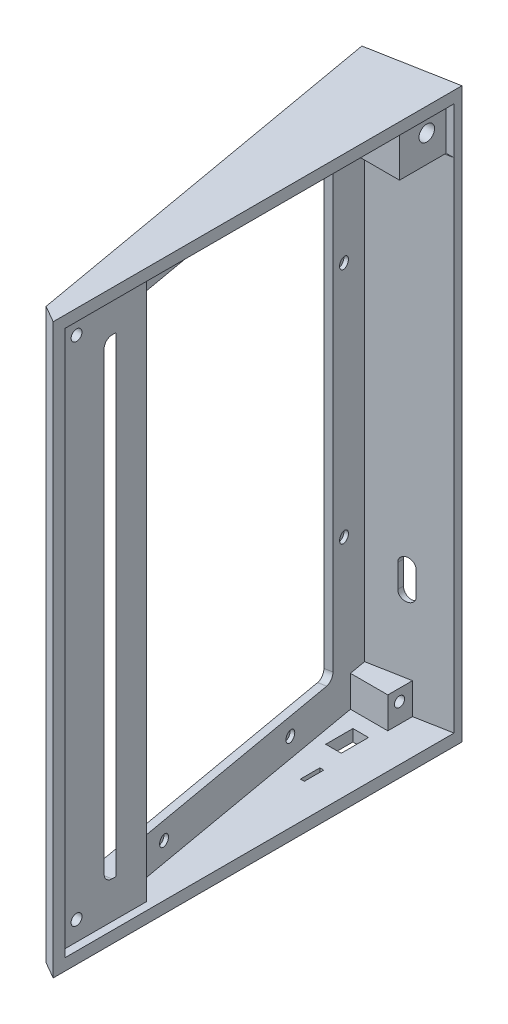
from build123d import *
from build123d.topology import SkipClean

# Parameters (mm, degrees)
EXTRUDE_1_DEPTH      = 180
SKETCH_5_W           = 76
SKETCH_5_H           = 121
CUT_EXTRUDE_2_DEPTH  = 2
CUT_EXTRUDE_3_REACH  = 232.539
SKETCH_7_W           = 99
SKETCH_7_H           = 174
SKETCH_10_R          = 1.4
CUT_EXTRUDE_5_DEPTH  = 1
SKETCH_11_R          = 1.4
CUT_EXTRUDE_6_DEPTH  = 1
EXTRUDE_3_REACH      = 232.539
SKETCH_12_W          = 23
SKETCH_12_H          = 140
SKETCH_13_W          = 11.509871418
SKETCH_13_H          = 121
CUT_EXTRUDE_7_DEPTH  = 2
SKETCH_17_W          = 22.064106518
SKETCH_17_H          = 180
EXTRUDE_9_DEPTH      = 2
CUT_EXTRUDE_9_DEPTH  = 180
CUT_EXTRUDE_10_DEPTH = 174
SKETCH_20_W          = 23
SKETCH_20_H          = 140
CUT_EXTRUDE_11_DEPTH = 2
EXTRUDE_10_REACH     = 232.359
SKETCH_23_W          = 12
SKETCH_23_H          = 12
FILLET_4_R           = 2
CUT_EXTRUDE_15_REACH = 243.825
EXTRUDE_11_REACH     = 232.539
SKETCH_27_W          = 8
SKETCH_27_H          = 8
SKETCH_28_W          = 8
SKETCH_28_H          = 8
CUT_EXTRUDE_16_DEPTH = 9
EXTRUDE_12_DEPTH     = 8
CUT_EXTRUDE_17_REACH = 243.825
CUT_EXTRUDE_18_REACH = 246.03
SKETCH_31_W          = 4
SKETCH_31_H          = 7
CUT_EXTRUDE_23_REACH = 225.195
CUT_EXTRUDE_25_REACH = 224.966
SKETCH_35_W          = 8
SKETCH_35_H          = 16
FILLET_5_R           = 0.5
CUT_EXTRUDE_26_REACH = 246.03
SKETCH_36_W          = 1
SKETCH_36_H          = 5
SKETCH_37_W          = 2
SKETCH_37_H          = 6
CUT_EXTRUDE_27_DEPTH = 1
SKETCH_38_R          = 1.3
CUT_EXTRUDE_28_DEPTH = 3
SKETCH_39_R          = 2
CUT_EXTRUDE_30_DEPTH = 3
SKETCH_40_R          = 1.4
CUT_EXTRUDE_31_DEPTH = 2
CUT_EXTRUDE_34_DEPTH = 2
CUT_EXTRUDE_35_DEPTH = 1
SKETCH_45_W          = 45.630615172
SKETCH_45_H          = 107.719789164
CUT_EXTRUDE_36_DEPTH = 34
SKETCH_47_R          = 1.4
CUT_EXTRUDE_37_DEPTH = 3
EXTRUDE_13_REACH     = 207.096
SKETCH_48_W          = 12
SKETCH_48_H          = 12
SKETCH_50_W          = 12
SKETCH_50_H          = 12
CUT_EXTRUDE_38_DEPTH = 2
SKETCH_51_R          = 2
CUT_EXTRUDE_39_DEPTH = 3
CUT_EXTRUDE_40_DEPTH = 211.503077075


with BuildPart() as part:
    # 草图1 → 凸台-拉伸1 (new body)
    with BuildSketch(Plane(origin=(0, 0, 0), x_dir=(1, 0, 0), z_dir=(0, 1, 0))):
        Polygon((82.903530501, -37.399262949), (82.903530501, -142.399262949), (78.573403482, -139.899262949), (61.208585715, -41.418487648), align=None)
    extrude(amount=EXTRUDE_1_DEPTH)

    # 草图5 → 切除-拉伸2 (cut)
    with BuildSketch(Plane(origin=(52.279942479, 0, -9.218364409), x_dir=(0.17364817766692414, 0, 0.9848077530122091), z_dir=(-0.9848077530122091, 0, 0.17364817766692414))):
        with Locations((101.418007121, 73)):
            Rectangle(SKETCH_5_W, SKETCH_5_H)
    extrude(amount=-CUT_EXTRUDE_2_DEPTH, mode=Mode.SUBTRACT)

    # 切除-拉伸3: up to this plane
    cut_extrude_3_end = Plane(origin=(54.249557985, 0, -9.565660764), z_dir=(-0.9848077530122091, 0, 0.17364817766692406))
    # 草图7 → 切除-拉伸3 (cut, up to the surface)
    with BuildSketch(Plane(origin=(82.903530501, 0, 0), x_dir=(0, 0, -1), z_dir=(1, 0, 0)), mode=Mode.PRIVATE) as cut_extrude_3_sk1:
        with Locations((-89.899262949, 90)):
            Rectangle(SKETCH_7_W, SKETCH_7_H)
    cut_extrude_3_tool1 = split(extrude(cut_extrude_3_sk1.sketch, amount=-CUT_EXTRUDE_3_REACH, mode=Mode.PRIVATE), bisect_by=cut_extrude_3_end, keep=Keep.BOTH, mode=Mode.PRIVATE)
    add(cut_extrude_3_tool1.solids().sort_by_distance((82.903531, 90, 89.899263))[0], mode=Mode.SUBTRACT)

    # 草图10 → 切除-拉伸5 (cut)
    with BuildSketch(Plane(origin=(54.249557985, 0, -9.565660764), x_dir=(-0.1736481776669242, 0, -0.9848077530122091), z_dir=(0.9848077530122091, 0, -0.1736481776669242))):
        with Locations((-59.918007121, 103.5)):
            Circle(SKETCH_10_R)
        with Locations((-59.918007121, 42.5)):
            Circle(SKETCH_10_R)
    extrude(amount=-CUT_EXTRUDE_5_DEPTH, mode=Mode.SUBTRACT)

    # 草图11 → 切除-拉伸6 (cut)
    with BuildSketch(Plane(origin=(54.249557985, 0, -9.565660764), x_dir=(-0.1736481776669242, 0, -0.9848077530122091), z_dir=(0.9848077530122091, 0, -0.1736481776669242))):
        with Locations((-116.918007121, 138)):
            Circle(SKETCH_11_R)
        with Locations((-76.918007121, 138)):
            Circle(SKETCH_11_R)
        with Locations((-116.918007121, 8)):
            Circle(SKETCH_11_R)
        with Locations((-76.918007121, 8)):
            Circle(SKETCH_11_R)
    extrude(amount=-CUT_EXTRUDE_6_DEPTH, mode=Mode.SUBTRACT)

    # 凸台-拉伸3: up to this plane
    extrude_3_end = Plane(origin=(54.249557985, 0, -9.565660764), z_dir=(-0.9848077530122091, 0, 0.17364817766692406))
    # 草图12 → 凸台-拉伸3 (add, up to the surface)
    with BuildSketch(Plane(origin=(82.903530501, 0, 0), x_dir=(0, 0, -1), z_dir=(1, 0, 0)), mode=Mode.PRIVATE) as extrude_3_sk1:
        with Locations((-127.899262949, 73)):
            Rectangle(SKETCH_12_W, SKETCH_12_H)
    extrude_3_tool1 = split(extrude(extrude_3_sk1.sketch, amount=-EXTRUDE_3_REACH, mode=Mode.PRIVATE), bisect_by=extrude_3_end, keep=Keep.BOTH, mode=Mode.PRIVATE)
    add(extrude_3_tool1.solids().sort_by_distance((82.903531, 73, 127.899263))[0])

    # 草图13 → 切除-拉伸7 (cut)
    with BuildSketch(Plane(origin=(54.249557985, 0, -9.565660764), x_dir=(0.1736481776669242, 0, 0.9848077530122091), z_dir=(-0.9848077530122091, 0, 0.1736481776669242))):
        with Locations((133.663071412, 73)):
            Rectangle(SKETCH_13_W, SKETCH_13_H)
    extrude(amount=-CUT_EXTRUDE_7_DEPTH, mode=Mode.SUBTRACT)

    # 草图17 → 凸台-拉伸9 (add)
    with BuildSketch(Plane(origin=(9.44967418, 0, 51.007389472), x_dir=(-0.9832686752161511, 0, 0.18216122622192457), z_dir=(-0.18216122622192457, 0, -0.9832686752161512))):
        with Locations((-63.671695749, 90)):
            Rectangle(SKETCH_17_W, SKETCH_17_H)
    extrude(amount=-EXTRUDE_9_DEPTH)

    # 草图18 → 切除-拉伸9 (cut)
    with BuildSketch(Plane.XZ):
        Polygon((82.903530501, 39.433295), (82.903530501, 37.399262949), (83.267852953, 39.3658003), align=None)
    extrude(amount=-CUT_EXTRUDE_9_DEPTH, mode=Mode.SUBTRACT)

    # 草图19 → 切除-拉伸10 (cut)
    with BuildSketch(Plane(origin=(0, 3, 0), x_dir=(1, 0, 0), z_dir=(0, 1, 0))):
        Polygon((77.596007668, -40.416571384), (82.903530501, -39.433295), (82.903530501, -40.399262949), align=None)
    extrude(amount=CUT_EXTRUDE_10_DEPTH, mode=Mode.SUBTRACT)

    # 草图20 → 切除-拉伸11 (cut)
    with BuildSketch(Plane(origin=(82.903530501, 0, 0), x_dir=(0, 0, -1), z_dir=(1, 0, 0))):
        with Locations((-127.899262949, 73)):
            Rectangle(SKETCH_20_W, SKETCH_20_H)
    extrude(amount=-CUT_EXTRUDE_11_DEPTH, mode=Mode.SUBTRACT)

    # 凸台-拉伸10: up to this plane
    extrude_10_end = Plane(origin=(54.249557985, 0, -9.565660764), z_dir=(-0.9848077530122091, 0, 0.17364817766692406))
    # 草图23 → 凸台-拉伸10 (add, up to the surface)
    with BuildSketch(Plane(origin=(80.903530501, 0, 0), x_dir=(0, 0, -1), z_dir=(1, 0, 0)), mode=Mode.PRIVATE) as extrude_10_sk1:
        with Locations((-133.399262949, 9)):
            Rectangle(SKETCH_23_W, SKETCH_23_H)
    extrude_10_tool1 = split(extrude(extrude_10_sk1.sketch, amount=-EXTRUDE_10_REACH, mode=Mode.PRIVATE), bisect_by=extrude_10_end, keep=Keep.BOTH, mode=Mode.PRIVATE)
    add(extrude_10_tool1.solids().sort_by_distance((80.903531, 9, 133.399263))[0])
    # 草图23 → 凸台-拉伸10 (add, up to the surface)
    with BuildSketch(Plane(origin=(80.903530501, 0, 0), x_dir=(0, 0, -1), z_dir=(1, 0, 0)), mode=Mode.PRIVATE) as extrude_10_sk2:
        with Locations((-45.433295, 171)):
            Rectangle(SKETCH_23_W, SKETCH_23_H)
    extrude_10_tool2 = split(extrude(extrude_10_sk2.sketch, amount=-EXTRUDE_10_REACH, mode=Mode.PRIVATE), bisect_by=extrude_10_end, keep=Keep.BOTH, mode=Mode.PRIVATE)
    add(extrude_10_tool2.solids().sort_by_distance((80.903531, 171, 45.433295))[0])
    # 草图23 → 凸台-拉伸10 (add, up to the surface)
    with BuildSketch(Plane(origin=(80.903530501, 0, 0), x_dir=(0, 0, -1), z_dir=(1, 0, 0)), mode=Mode.PRIVATE) as extrude_10_sk3:
        with Locations((-133.399262949, 171)):
            Rectangle(SKETCH_23_W, SKETCH_23_H)
    extrude_10_tool3 = split(extrude(extrude_10_sk3.sketch, amount=-EXTRUDE_10_REACH, mode=Mode.PRIVATE), bisect_by=extrude_10_end, keep=Keep.BOTH, mode=Mode.PRIVATE)
    add(extrude_10_tool3.solids().sort_by_distance((80.903531, 171, 133.399263))[0])

    # 圆角4
    # the kernel refuses this fillet: 2 mm, written as the material it adds along each edge
    with BuildSketch(Plane(origin=(63.292363847, 133.5, 53.236180684), x_dir=(0, -1, 0), z_dir=(0.9848077530122091, 0, -0.17364817766692414)), Plane(origin=(63.292363847, 12.5, 53.236180684), x_dir=(0.17364817766692411, -2.4868995751603412e-14, 0.9848077530122092), z_dir=(0.9848077530122091, 0, -0.17364817766692414))) as fillet_4_piece_1:
        with BuildLine():
            CenterArc((FILLET_4_R, -FILLET_4_R), FILLET_4_R, 90, 90)
            Line((0, -FILLET_4_R), (0, 0))
            Line((0, 0), (FILLET_4_R, 0))
        make_face()
    extrude(amount=2)
    with BuildSketch(Plane(origin=(80.428856362, 133.5, 127.386977203), x_dir=(0, -1, 0), z_dir=(-0.9848077530122102, 0, 0.17364817766691837))) as fillet_4_piece_2:
        with BuildLine():
            CenterArc((FILLET_4_R, -FILLET_4_R), FILLET_4_R, 90, 90)
            Line((0, -FILLET_4_R), (0, 0))
            Line((0, 0), (FILLET_4_R, 0))
        make_face()
    extrude(amount=4)
    with BuildSketch(Plane(origin=(76.48962535, 12.5, 128.081569913), x_dir=(-0.17364817766691837, 0, -0.9848077530122102), z_dir=(0.9848077530122102, 0, -0.17364817766691837))) as fillet_4_piece_3:
        with BuildLine():
            CenterArc((FILLET_4_R, FILLET_4_R), FILLET_4_R, 180, 90)
            Line((0, FILLET_4_R), (0, 0))
            Line((0, 0), (FILLET_4_R, 0))
        make_face()
    extrude(amount=2)
    with BuildSketch(Plane(origin=(65.587064134, 12.5, 130.003985614), x_dir=(-0.17364817766691837, 0, -0.9848077530122102), z_dir=(0.9848077530122102, 0, -0.17364817766691837))) as fillet_4_piece_4_section:
        with BuildLine():
            CenterArc((FILLET_4_R, FILLET_4_R), FILLET_4_R, 180, 90)
            Line((0, FILLET_4_R), (0, 0))
            Line((0, 0), (FILLET_4_R, 0))
        make_face()
    fillet_4_piece_4 = extrude(amount=15.070750796, mode=Mode.PRIVATE)
    fillet_4_piece_4 = split(fillet_4_piece_4, bisect_by=Plane(origin=(65.587064134, 12.5, 127.399262949), z_dir=(0, 0, 1)), keep=Keep.TOP, mode=Mode.PRIVATE)
    fillet_4_piece_4 = split(fillet_4_piece_4, bisect_by=Plane(origin=(76.48962535, 12.5, 128.081569913), z_dir=(0.9848077530122091, 0, -0.17364817766692425)), keep=Keep.TOP, mode=Mode.PRIVATE)
    add(fillet_4_piece_4)
    with BuildSketch(Plane(origin=(65.587064134, 12.5, 130.003985614), x_dir=(-0.17364817766691837, 0, -0.9848077530122102), z_dir=(0.9848077530122102, 0, -0.17364817766691837))) as fillet_4_piece_5_section:
        with BuildLine():
            CenterArc((FILLET_4_R, FILLET_4_R), FILLET_4_R, 180, 90)
            Line((0, FILLET_4_R), (0, 0))
            Line((0, 0), (FILLET_4_R, 0))
        make_face()
    fillet_4_piece_5 = extrude(amount=15.070750796, mode=Mode.PRIVATE)
    fillet_4_piece_5 = split(fillet_4_piece_5, bisect_by=Plane(origin=(65.587064134, 12.5, 127.399262949), z_dir=(0, 0, -1)), keep=Keep.TOP, mode=Mode.PRIVATE)
    fillet_4_piece_5 = split(fillet_4_piece_5, bisect_by=Plane(origin=(76.48962535, 12.5, 128.081569913), z_dir=(0.9848077530122091, 0, -0.17364817766692425)), keep=Keep.TOP, mode=Mode.PRIVATE)
    add(fillet_4_piece_5)

    # 草图26 → 切除-拉伸15 (cut, up to next)
    with BuildSketch(Plane(origin=(0, 177, 0), x_dir=(1, 0, 0), z_dir=(0, 1, 0)), mode=Mode.PRIVATE) as cut_extrude_15_sk1:
        Polygon((63.175196657, -41.054151562), (71.924245603, -39.433295), (62.889395913, -39.433295), align=None)
    cut_extrude_15_tool1 = extrude(cut_extrude_15_sk1.sketch, amount=-CUT_EXTRUDE_15_REACH, mode=Mode.PRIVATE) & part.part
    add(cut_extrude_15_tool1.solids().sort_by_distance((65.996279, 177, 39.973581))[0], mode=Mode.SUBTRACT)

    # 凸台-拉伸11: up to this plane
    extrude_11_end = Plane(origin=(54.249557985, 0, -9.565660764), z_dir=(-0.9848077530122091, 0, 0.17364817766692406))
    # 草图27 → 凸台-拉伸11 (add, up to the surface)
    with BuildSketch(Plane(origin=(82.903530501, 0, 0), x_dir=(0, 0, -1), z_dir=(1, 0, 0)), mode=Mode.PRIVATE) as extrude_11_sk1:
        with Locations((-43.433295, 7)):
            Rectangle(SKETCH_27_W, SKETCH_27_H)
    extrude_11_tool1 = split(extrude(extrude_11_sk1.sketch, amount=-EXTRUDE_11_REACH, mode=Mode.PRIVATE), bisect_by=extrude_11_end, keep=Keep.BOTH, mode=Mode.PRIVATE)
    add(extrude_11_tool1.solids().sort_by_distance((82.903531, 7, 43.433295))[0])

    # 草图28 → 切除-拉伸16 (cut)
    with BuildSketch(Plane(origin=(82.903530501, 0, 0), x_dir=(0, 0, -1), z_dir=(1, 0, 0))):
        with Locations((-43.433295, 7)):
            Rectangle(SKETCH_28_W, SKETCH_28_H)
    extrude(amount=-CUT_EXTRUDE_16_DEPTH, mode=Mode.SUBTRACT)

    # 草图29 → 凸台-拉伸12 (add)
    with BuildSketch(Plane.XZ.offset(-11)):
        Polygon((73.903530501, 41.100642977), (73.903530501, 39.433295), (82.903530501, 39.433295), align=None)
    extrude(amount=EXTRUDE_12_DEPTH)

    # 草图30 → 切除-拉伸17 (cut, up to next)
    with BuildSketch(Plane.XZ.offset(-3), mode=Mode.PRIVATE) as cut_extrude_17_sk1:
        Polygon((71.924245603, 39.433295), (63.175196657, 41.054151562), (62.889395913, 39.433295), align=None)
    cut_extrude_17_tool1 = extrude(cut_extrude_17_sk1.sketch, amount=-CUT_EXTRUDE_17_REACH, mode=Mode.PRIVATE) & part.part
    add(cut_extrude_17_tool1.solids().sort_by_distance((65.996279, 3, 39.973581))[0], mode=Mode.SUBTRACT)

    # 草图31 → 切除-拉伸18 (cut, up to next)
    with BuildSketch(Plane.XZ, mode=Mode.PRIVATE) as cut_extrude_18_sk1:
        with Locations((70.903530501, 54.899262949)):
            Rectangle(SKETCH_31_W, SKETCH_31_H)
    cut_extrude_18_tool1 = extrude(cut_extrude_18_sk1.sketch, amount=-CUT_EXTRUDE_18_REACH, mode=Mode.PRIVATE) & part.part
    add(cut_extrude_18_tool1.solids().sort_by_distance((70.903531, 0, 54.899263))[0], mode=Mode.SUBTRACT)

    # 切除-拉伸23: up to this plane
    cut_extrude_23_end = Plane(origin=(9.813996633, 0, 52.973926823), z_dir=(-0.18216122622192446, 0, -0.9832686752161511))
    # 草图32 → 切除-拉伸23 (cut, up to the surface)
    with BuildSketch(Plane(origin=(0, 0, 39.719262949), x_dir=(-1, 0, 0), z_dir=(0, 0, -1)), mode=Mode.PRIVATE) as cut_extrude_23_sk1:
        with BuildLine():
            Line((-70.708585715, 36), (-70.708585715, 30))
            ThreePointArc((-70.708585715, 30), (-72.708585715, 28), (-74.708585715, 30))
            Line((-74.708585715, 30), (-74.708585715, 36))
            ThreePointArc((-74.708585715, 36), (-72.708585715, 38), (-70.708585715, 36))
        make_face()
    cut_extrude_23_tool1 = split(extrude(cut_extrude_23_sk1.sketch, amount=-CUT_EXTRUDE_23_REACH, mode=Mode.PRIVATE), bisect_by=cut_extrude_23_end, keep=Keep.BOTH, mode=Mode.PRIVATE)
    add(cut_extrude_23_tool1.solids().sort_by_distance((72.708586, 33, 39.719263))[0], mode=Mode.SUBTRACT)

    # 切除-拉伸25: up to this plane
    cut_extrude_25_end = Plane(origin=(61.208585715, 180, 41.418487648), z_dir=(0.18216122622192454, 0, 0.9832686752161511))
    # 草图35 → 切除-拉伸25 (cut, up to the surface)
    with BuildSketch(Plane(origin=(0, 0, 40.219262949), x_dir=(-1, 0, 0), z_dir=(0, 0, -1)), mode=Mode.PRIVATE) as cut_extrude_25_sk1:
        with Locations((-72.708585715, 33)):
            Rectangle(SKETCH_35_W, SKETCH_35_H)
    cut_extrude_25_tool1 = split(extrude(cut_extrude_25_sk1.sketch, amount=CUT_EXTRUDE_25_REACH, mode=Mode.PRIVATE), bisect_by=cut_extrude_25_end, keep=Keep.BOTH, mode=Mode.PRIVATE)
    add(cut_extrude_25_tool1.solids().sort_by_distance((72.708586, 33, 40.219263))[0], mode=Mode.SUBTRACT)

    # 圆角5
    fillet_5_edges = [part.edges().sort_by_distance(p)[0] for p in [
        (68.708585715, 41, 40.124146975),
        (68.708585715, 25, 40.124146975),
        (76.708585715, 25, 39.38310343),
        (76.708585715, 41, 39.38310343),
    ]]
    fillet(fillet_5_edges, radius=FILLET_5_R)

    # 草图36 → 切除-拉伸26 (cut, up to next)
    with BuildSketch(Plane.XZ, mode=Mode.PRIVATE) as cut_extrude_26_sk1:
        with Locations((73.903530501, 66.899262949)):
            Rectangle(SKETCH_36_W, SKETCH_36_H)
    cut_extrude_26_tool1 = extrude(cut_extrude_26_sk1.sketch, amount=-CUT_EXTRUDE_26_REACH, mode=Mode.PRIVATE) & part.part
    add(cut_extrude_26_tool1.solids().sort_by_distance((73.903531, 0, 66.899263))[0], mode=Mode.SUBTRACT)

    # 草图37 → 切除-拉伸27 (cut)
    with BuildSketch(Plane.XZ):
        with Locations((73.903530501, 66.899262949)):
            Rectangle(SKETCH_37_W, SKETCH_37_H)
    extrude(amount=-CUT_EXTRUDE_27_DEPTH, mode=Mode.SUBTRACT)

    # 草图38 → 切除-拉伸28 (cut)
    with BuildSketch(Plane(origin=(73.903530501, 0, 0), x_dir=(0, 0, -1), z_dir=(1, 0, 0))):
        with Locations((-44.433295, 8)):
            Circle(SKETCH_38_R)
    extrude(amount=-CUT_EXTRUDE_28_DEPTH, mode=Mode.SUBTRACT)

    # 草图39 → 切除-拉伸30 (cut)
    with BuildSketch(Plane(origin=(80.903530501, 0, 0), x_dir=(0, 0, -1), z_dir=(1, 0, 0))):
        with Locations((-44.433295, 172)):
            Circle(SKETCH_39_R)
    extrude(amount=-CUT_EXTRUDE_30_DEPTH, mode=Mode.SUBTRACT)

    # 草图40 → 切除-拉伸31 (cut)
    with BuildSketch(Plane(origin=(80.903530501, 0, 0), x_dir=(0, 0, -1), z_dir=(1, 0, 0))):
        with Locations((-134.399262949, 172)):
            Circle(SKETCH_40_R)
        with Locations((-134.399262949, 8)):
            Circle(SKETCH_40_R)
    extrude(amount=-CUT_EXTRUDE_31_DEPTH, mode=Mode.SUBTRACT)

    # 草图42 → 切除-拉伸34 (cut)
    with SkipClean():  # the faces are left unmerged after this step: merging them gives an invalid solid
        with BuildSketch(Plane(origin=(54.249557985, 0, -9.565660764), x_dir=(0.17364817766692428, 0, 0.9848077530122091), z_dir=(-0.9848077530122092, 0, 0.17364817766692428))):
            with BuildLine():
                Line((139.077828434, 15), (139.077828434, 13.384207363))
                ThreePointArc((139.077828434, 13.384207363), (139.331073067, 13.916751608), (139.418007121, 14.5))
                Line((139.418007121, 14.5), (139.418007121, 15))
                Line((139.418007121, 15), (139.077828434, 15))
            make_face()
        extrude(amount=-CUT_EXTRUDE_34_DEPTH, mode=Mode.SUBTRACT)

    # 草图43 → 切除-拉伸35 (cut)
    with SkipClean():  # the faces are left unmerged after this step: merging them gives an invalid solid
        with BuildSketch(Plane(origin=(56.219173491, 0, -9.91295712), x_dir=(0.17364817766692442, 0, 0.9848077530122091), z_dir=(-0.9848077530122091, 0, 0.17364817766692442))):
            with BuildLine():
                Line((139.418007121, 14.5), (139.418007121, 131.5))
                ThreePointArc((139.418007121, 131.5), (138.832220683, 132.914213562), (137.418007121, 133.5))
                Line((137.418007121, 133.5), (128.260789665, 133.5))
                Line((128.260789665, 133.5), (128.260789665, 12.5))
                Line((128.260789665, 12.5), (137.418007121, 12.5))
                ThreePointArc((137.418007121, 12.5), (138.832220683, 13.085786438), (139.418007121, 14.5))
            make_face()
        extrude(amount=-CUT_EXTRUDE_35_DEPTH, mode=Mode.SUBTRACT)

    # 草图45 → 切除-拉伸36 (cut)
    with SkipClean():  # the faces are left unmerged after this step: merging them gives an invalid solid
        with BuildSketch(Plane(origin=(0, 143, 0), x_dir=(-1, 0, 0), z_dir=(0, -1, 0))):
            with Locations((-69.740033364, -89.554323094)):
                Rectangle(SKETCH_45_W, SKETCH_45_H)
        extrude(amount=-CUT_EXTRUDE_36_DEPTH, mode=Mode.SUBTRACT)


with BuildPart() as cut_extrude_36_piece_1:
    # of the separate pieces the step leaves, piece 1, a body of its own (cut_extrude_36_pieces)
    add(part.part.solids().sort_by_distance((61.208585715, 0, 41.418487648))[0])


with BuildPart() as cut_extrude_36_piece_2:
    # of the separate pieces the step leaves, piece 2, a body of its own (cut_extrude_36_pieces)
    add(part.part.solids().sort_by_distance((61.208585715, 177, 41.418487648))[0])


with BuildPart() as cut_extrude_36_piece_2_1:
    # Move Body 1: read off the stored shape, not the designer's step
    # Move Body 1: moved
    add(cut_extrude_36_piece_2.part.moved(Location((0, -34, 0))))


with BuildPart() as cut_extrude_36_piece_1_1:
    add(cut_extrude_36_piece_1.part)

    # Combine 1: union 切除-拉伸36 piece 2
    add(cut_extrude_36_piece_2_1.part)

    # 草图47 → 切除-拉伸37 (cut)
    with SkipClean():  # the faces are left unmerged after this step: merging them gives an invalid solid
        with BuildSketch(Plane(origin=(80.903530501, 0, 0), x_dir=(0, 0, -1), z_dir=(1, 0, 0))):
            with Locations((-134.399262949, 138)):
                Circle(SKETCH_47_R)
        extrude(amount=-CUT_EXTRUDE_37_DEPTH, mode=Mode.SUBTRACT)

    # 凸台-拉伸13: up to this plane
    with SkipClean():  # the faces are left unmerged after this step: merging them gives an invalid solid
        extrude_13_end = Plane(origin=(54.249557985, 0, -9.565660764), z_dir=(-0.9848077530122091, 0, 0.17364817766692406))
        # 草图48 → 凸台-拉伸13 (add, up to the surface)
        with BuildSketch(Plane(origin=(82.903530501, 0, 0), x_dir=(0, 0, -1), z_dir=(1, 0, 0)), mode=Mode.PRIVATE) as extrude_13_sk1:
            with Locations((-45.433295, 137)):
                Rectangle(SKETCH_48_W, SKETCH_48_H)
        extrude_13_tool1 = split(extrude(extrude_13_sk1.sketch, amount=-EXTRUDE_13_REACH, mode=Mode.PRIVATE), bisect_by=extrude_13_end, keep=Keep.BOTH, mode=Mode.PRIVATE)
        add(extrude_13_tool1.solids().sort_by_distance((82.903531, 137, 45.433295))[0])

    # 草图50 → 切除-拉伸38 (cut)
    with SkipClean():  # the faces are left unmerged after this step: merging them gives an invalid solid
        with BuildSketch(Plane(origin=(82.903530501, 0, 0), x_dir=(0, 0, -1), z_dir=(1, 0, 0))):
            with Locations((-45.433295, 137)):
                Rectangle(SKETCH_50_W, SKETCH_50_H)
        extrude(amount=-CUT_EXTRUDE_38_DEPTH, mode=Mode.SUBTRACT)

    # 草图51 → 切除-拉伸39 (cut)
    with SkipClean():  # the faces are left unmerged after this step: merging them gives an invalid solid
        with BuildSketch(Plane(origin=(80.903530501, 0, 0), x_dir=(0, 0, -1), z_dir=(1, 0, 0))):
            with Locations((-44.433295, 138)):
                Circle(SKETCH_51_R)
        extrude(amount=-CUT_EXTRUDE_39_DEPTH, mode=Mode.SUBTRACT)

    # 草图52 → 切除-拉伸40 (cut, through all)
    with SkipClean():  # the faces are left unmerged after this step: merging them gives an invalid solid
        with BuildSketch(Plane.XZ.offset(-131)):
            Polygon((71.924245603, 39.433295), (63.175196657, 41.054151562), (62.889395913, 39.433295), align=None)
        extrude(amount=-CUT_EXTRUDE_40_DEPTH, mode=Mode.SUBTRACT)


solid = cut_extrude_36_piece_1_1.part
